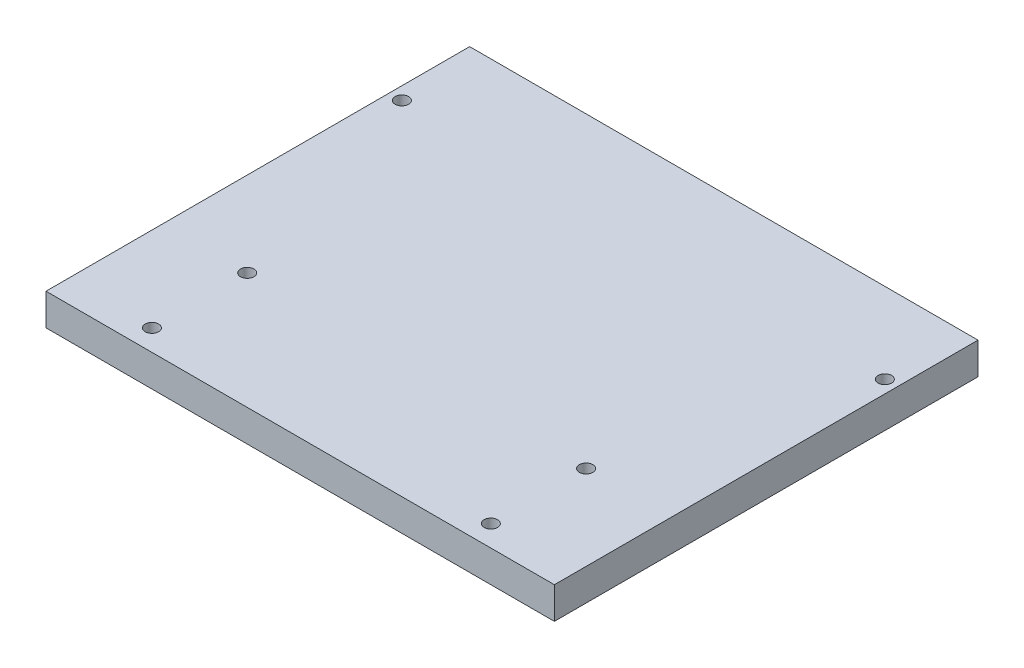
from build123d import *

# Parameters (mm, degrees)
SKETCH1_W                      = 152.4
SKETCH1_H                      = 127
BOSS_EXTRUDE1_DEPTH            = 9.525
F_10_32_TAPPED_HOLE1_D         = 4.0386
F_10_32_TAPPED_HOLE2_OUTLINE_R = 2.0193
F_10_32_TAPPED_HOLE2_DEPTH     = 9.525


# Read off the part's stored shape, not the designer's step: #10-32 Tapped Hole2
with BuildPart() as part:
    # Sketch1 → Boss-Extrude1 (new body)
    with BuildSketch(Plane(origin=(0, 0, 0), x_dir=(1, 0, 0), z_dir=(0, 1, 0))):
        with Locations((76.2, 63.5)):
            Rectangle(SKETCH1_W, SKETCH1_H)
    extrude(amount=BOSS_EXTRUDE1_DEPTH)

    # #10-32 Tapped Hole1 (through all)
    with Locations(Plane(origin=(25.4, 9.525, -6.35), x_dir=(0, 0, 1), z_dir=(0, 1, 0))):
        with Locations((0, 0), (-28.575, 0), (-28.575, 101.6), (0, 101.6)):
            Hole(F_10_32_TAPPED_HOLE1_D / 2)

    # #10-32 Tapped Hole2 outline → #10-32 Tapped Hole2 (cut)
    with BuildSketch(Plane(origin=(0, 0, 0), x_dir=(1, 0, 0), z_dir=(0, 1, 0))):
        with Locations((148.59, 102.87)):
            Circle(F_10_32_TAPPED_HOLE2_OUTLINE_R)
        with Locations((3.81, 102.87)):
            Circle(F_10_32_TAPPED_HOLE2_OUTLINE_R)
    extrude(amount=F_10_32_TAPPED_HOLE2_DEPTH, mode=Mode.SUBTRACT)


solid = part.part
